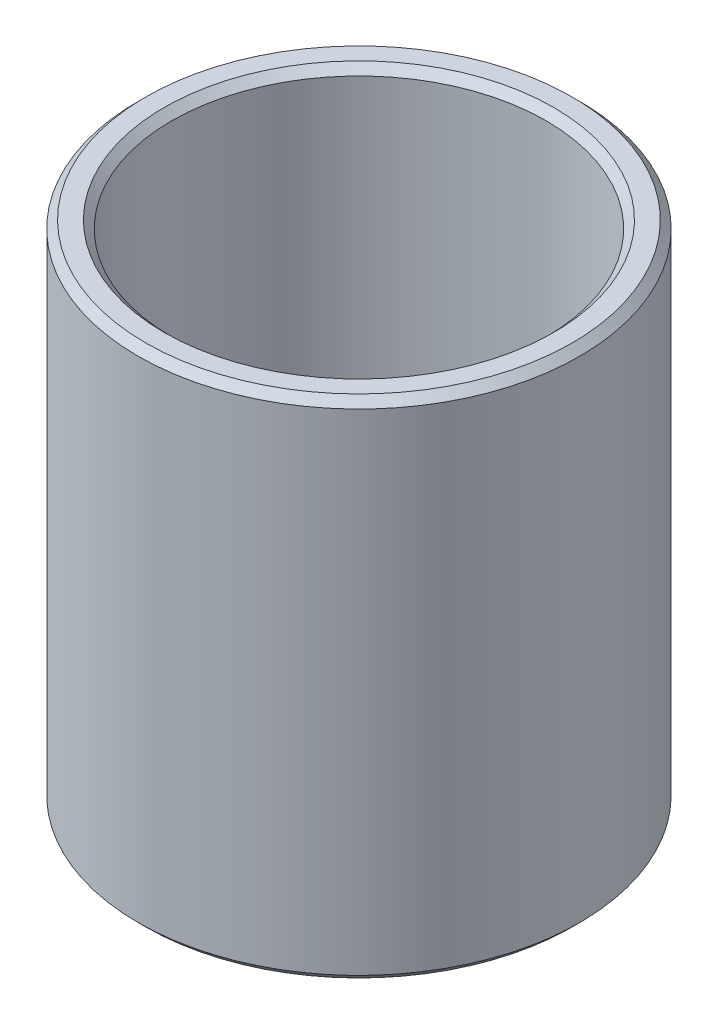
from build123d import *

# Parameters (mm, degrees)
SKETCH1_R           = 20
BOSS_EXTRUDE1_DEPTH = 45.81518915
SKETCH2_R           = 16.955145204
CUT_EXTRUDE1_DEPTH  = 54.842655551
CHAMFER1_SIZE       = 0.694029962


with BuildPart() as part:
    # Sketch1 → Boss-Extrude1 (new body)
    with BuildSketch(Plane(origin=(0, 0, 0), x_dir=(1, 0, 0), z_dir=(0, 1, 0))):
        Circle(SKETCH1_R)
    extrude(amount=BOSS_EXTRUDE1_DEPTH)

    # Sketch2 → Cut-Extrude1 (cut, through all)
    with BuildSketch(Plane(origin=(0, 0, 0), x_dir=(1, 0, 0), z_dir=(0, 1, 0))):
        Circle(SKETCH2_R)
    extrude(amount=CUT_EXTRUDE1_DEPTH, mode=Mode.SUBTRACT)

    # Chamfer1
    chamfer1_edges = [part.edges().sort_by_distance(p)[0] for p in [
        (-16.955145204, 45.81518915, 0),
        (-16.955145204, 0, 0),
        (-20, 0, 0),
        (-20, 45.81518915, 0),
    ]]
    chamfer(chamfer1_edges, length=CHAMFER1_SIZE)


solid = part.part
